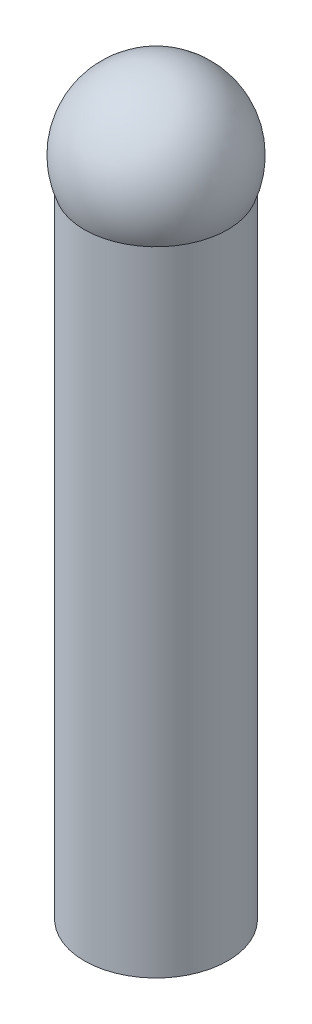
from build123d import *

# Parameters (mm, degrees)
SKETCH_1_R      = 0.65
EXTRUDE_1_DEPTH = 6


with BuildPart() as part:
    # Эскиз1 → Бобышка-Вытянуть1 (new body)
    with BuildSketch(Plane(origin=(0, 0, 0), x_dir=(1, 0, 0), z_dir=(0, 1, 0))):
        Circle(SKETCH_1_R)
    extrude(amount=EXTRUDE_1_DEPTH)

    # Эскиз3 → Повернуть23 (revolve)
    with BuildSketch(Plane.XY):
        with BuildLine():
            Line((-0.7, 6), (0.7, 6))
            ThreePointArc((0.7, 6), (0, 6.7), (-0.7, 6))
        make_face()
    revolve(axis=Axis((0.7, 6, 0), (-1, 0, 0)))


solid = part.part
